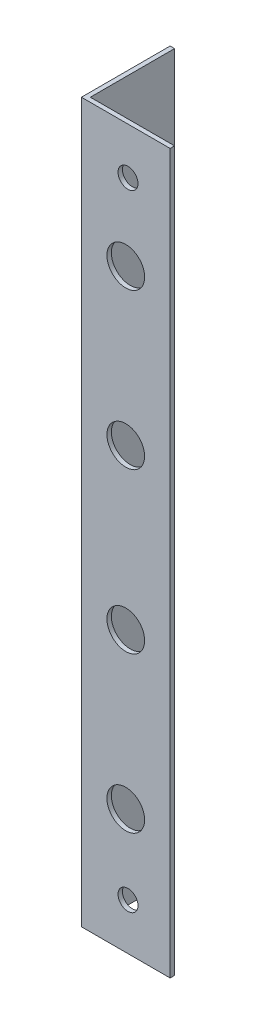
from build123d import *

# Parameters (mm, degrees)
EXTRUDE_1_DEPTH     = 162
SKETCH_2_R          = 4.25
CUT_EXTRUDE_1_DEPTH = 165.450600485
SKETCH_3_R          = 2.25
CUT_EXTRUDE_2_DEPTH = 165.331981063


with BuildPart() as part:
    # Эскиз1 → Бобышка-Вытянуть1 (new body)
    with BuildSketch(Plane(origin=(0, 0, 0), x_dir=(1, 0, 0), z_dir=(0, 1, 0))):
        Polygon((0, 0), (0, 20), (1, 20), (1, 1), (20, 1), (20, 0), align=None)
    extrude(amount=EXTRUDE_1_DEPTH)

    # Эскиз2 → Вырез-Вытянуть1 (cut, through all)
    with BuildSketch(Plane.XY):
        with Locations((10, 134)):
            Circle(SKETCH_2_R)
        with Locations((10, 99)):
            Circle(SKETCH_2_R)
        with Locations((10, 63)):
            Circle(SKETCH_2_R)
        with Locations((10, 28)):
            Circle(SKETCH_2_R)
    extrude(amount=-CUT_EXTRUDE_1_DEPTH, mode=Mode.SUBTRACT)

    # Эскиз3 → Вырез-Вытянуть2 (cut, through all)
    with BuildSketch(Plane(origin=(0, 0, -1), x_dir=(-1, 0, 0), z_dir=(0, 0, -1))):
        with Locations((-10.5, 10.5)):
            Circle(SKETCH_3_R)
        with Locations((-10.5, 151.5)):
            Circle(SKETCH_3_R)
    extrude(amount=-CUT_EXTRUDE_2_DEPTH, mode=Mode.SUBTRACT)


solid = part.part
